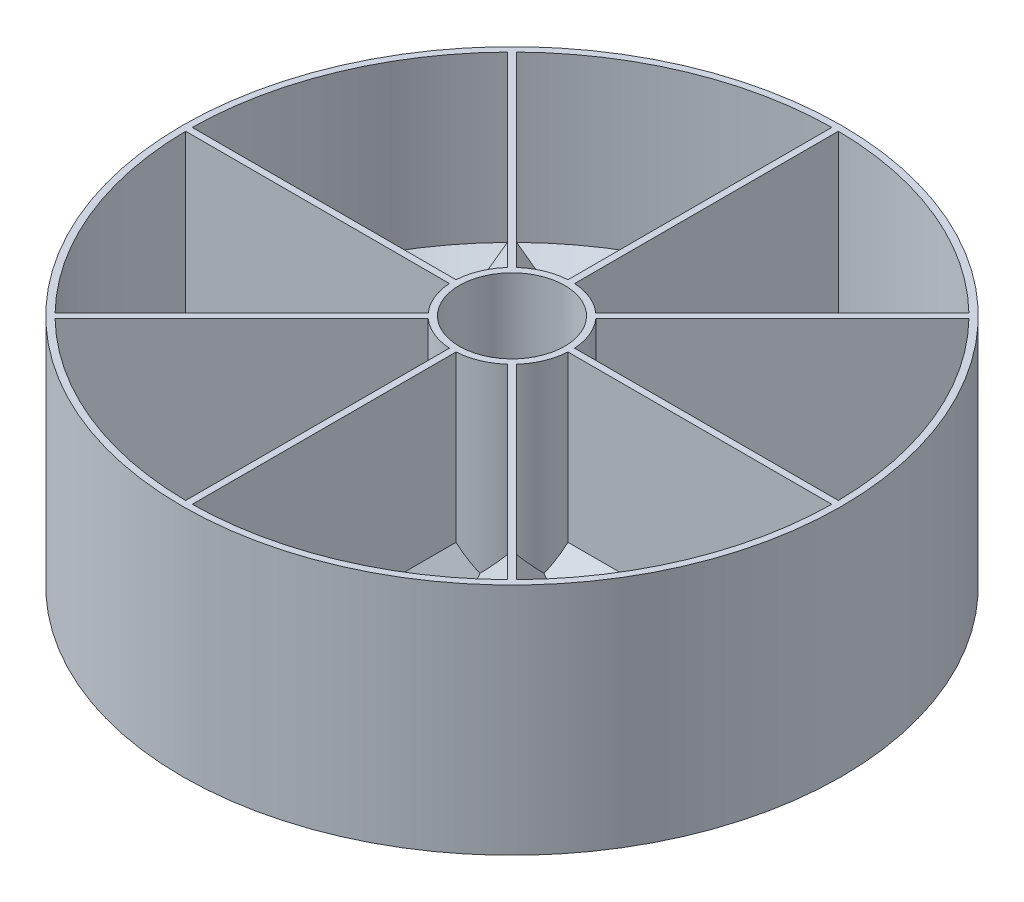
from build123d import *

# Parameters (mm, degrees)
SKETCH2_R           = 100
SKETCH2_R_2         = 98
BOSS_EXTRUDE2_DEPTH = 70
SKETCH3_R           = 18
SKETCH3_R_2         = 16
BOSS_EXTRUDE3_DEPTH = 70
BOSS_EXTRUDE4_DEPTH = 70
CIRPATTERN1_COUNT   = 8
BOSS_EXTRUDE5_START = 1
SKETCH5_R           = 100
BOSS_EXTRUDE5_DEPTH = 1
SKETCH9_R           = 16
BOSS_EXTRUDE6_DEPTH = 10
CUT_EXTRUDE2_DEPTH  = 154.622914957
CHAMFER1_SIZE       = 20
CUT_EXTRUDE3_DEPTH  = 158.797338381
CIRPATTERN2_COUNT   = 8


with BuildPart() as part:
    # Sketch2 → Boss-Extrude2 (new body)
    with BuildSketch(Plane(origin=(0, 0, 0), x_dir=(1, 0, 0), z_dir=(0, 1, 0))):
        Circle(SKETCH2_R)
        Circle(SKETCH2_R_2, mode=Mode.SUBTRACT)
    extrude(amount=BOSS_EXTRUDE2_DEPTH)



with BuildPart() as body_2:
    # Sketch3 → Boss-Extrude3 (new body)
    with BuildSketch(Plane(origin=(0, 0, 0), x_dir=(1, 0, 0), z_dir=(0, 1, 0))):
        Circle(SKETCH3_R)
        Circle(SKETCH3_R_2, mode=Mode.SUBTRACT)
    extrude(amount=BOSS_EXTRUDE3_DEPTH)

    # Sketch4 → Boss-Extrude4 (add)
    with BuildSketch(Plane(origin=(0, 0, 0), x_dir=(1, 0, 0), z_dir=(0, 1, 0))):
        with BuildLine():
            ThreePointArc((1, -17.972200756), (0, -18), (-1, -17.972200756))
            Line((-1, -17.972200756), (-1, -97.994897826))
            ThreePointArc((-1, -97.994897826), (0, -98), (1, -97.994897826))
            Line((1, -97.994897826), (1, -17.972200756))
        make_face()
    boss_extrude4 = extrude(amount=BOSS_EXTRUDE4_DEPTH)

    # CirPattern1: Boss-Extrude4 ×8 about axis
    cirpattern1_axis = Axis((0, 70, 0), (0, -1, 0))
    for i in range(1, CIRPATTERN1_COUNT):
        add(boss_extrude4.rotate(cirpattern1_axis, i * 360 / CIRPATTERN1_COUNT))


with BuildPart() as part_1:
    add(part.part)

    add(body_2.part)  # Boss-Extrude5 merges body 2
    # Sketch5 → Boss-Extrude5 (add)
    with BuildSketch(Plane.XZ.offset(BOSS_EXTRUDE5_START)):
        Circle(SKETCH5_R)
    extrude(amount=-BOSS_EXTRUDE5_DEPTH)

    # Sketch9 → Boss-Extrude6 (add)
    with BuildSketch(Plane(origin=(0, 0, 0), x_dir=(1, 0, 0), z_dir=(0, 1, 0))):
        Circle(SKETCH9_R)
    extrude(amount=BOSS_EXTRUDE6_DEPTH)

    # Sketch10 → Cut-Extrude2 (cut, through all)
    with BuildSketch(Plane(origin=(0, 10, 0), x_dir=(1, 0, 0), z_dir=(0, 1, 0))):
        Polygon((0, 16), (-13.856406461, 8), (-13.856406461, -8), (0, -16), (13.856406461, -8), (13.856406461, 8), align=None)
    extrude(amount=-CUT_EXTRUDE2_DEPTH, mode=Mode.SUBTRACT)

    # Chamfer1
    chamfer1_edges = [part_1.edges().sort_by_distance(p)[0] for p in [
        (40.29345412, 0, -41.707667682),
    ]]
    chamfer(chamfer1_edges, length=CHAMFER1_SIZE)
    chamfer1_2_edges = [part_1.edges().sort_by_distance(p)[0] for p in [
        (40.29345412, 0, 41.707667682),
    ]]
    chamfer(chamfer1_2_edges, length=CHAMFER1_SIZE)
    chamfer1_3_edges = [part_1.edges().sort_by_distance(p)[0] for p in [
        (1, 0, 64.346691318),
    ]]
    chamfer(chamfer1_3_edges, length=CHAMFER1_SIZE)
    chamfer1_4_edges = [part_1.edges().sort_by_distance(p)[0] for p in [
        (-57.983549291, 0, 1),
    ]]
    chamfer(chamfer1_4_edges, length=CHAMFER1_SIZE)
    chamfer1_5_edges = [part_1.edges().sort_by_distance(p)[0] for p in [
        (-40.29345412, 0, 41.707667682),
    ]]
    chamfer(chamfer1_5_edges, length=CHAMFER1_SIZE)
    chamfer1_6_edges = [part_1.edges().sort_by_distance(p)[0] for p in [
        (-1, 0, 64.346691318),
    ]]
    chamfer(chamfer1_6_edges, length=CHAMFER1_SIZE)
    chamfer1_7_edges = [part_1.edges().sort_by_distance(p)[0] for p in [
        (41.707667682, 0, 40.29345412),
    ]]
    chamfer(chamfer1_7_edges, length=CHAMFER1_SIZE)
    chamfer1_8_edges = [part_1.edges().sort_by_distance(p)[0] for p in [
        (64.346691318, 0, 1),
    ]]
    chamfer(chamfer1_8_edges, length=CHAMFER1_SIZE)
    chamfer1_9_edges = [part_1.edges().sort_by_distance(p)[0] for p in [
        (57.983549291, 0, -1),
    ]]
    chamfer(chamfer1_9_edges, length=CHAMFER1_SIZE)
    chamfer1_10_edges = [part_1.edges().sort_by_distance(p)[0] for p in [
        (46.207088559, 0, -44.792874997),
    ]]
    chamfer(chamfer1_10_edges, length=CHAMFER1_SIZE)
    chamfer1_11_edges = [part_1.edges().sort_by_distance(p)[0] for p in [
        (1, 0, -64.346691318),
    ]]
    chamfer(chamfer1_11_edges, length=CHAMFER1_SIZE)
    chamfer1_12_edges = [part_1.edges().sort_by_distance(p)[0] for p in [
        (-1, 0, -57.983549291),
    ]]
    chamfer(chamfer1_12_edges, length=CHAMFER1_SIZE)
    chamfer1_13_edges = [part_1.edges().sort_by_distance(p)[0] for p in [
        (-41.707667682, 0, -40.29345412),
    ]]
    chamfer(chamfer1_13_edges, length=CHAMFER1_SIZE)
    chamfer1_14_edges = [part_1.edges().sort_by_distance(p)[0] for p in [
        (-64.346691318, 0, -1),
    ]]
    chamfer(chamfer1_14_edges, length=CHAMFER1_SIZE)
    chamfer1_15_edges = [part_1.edges().sort_by_distance(p)[0] for p in [
        (-46.207088559, 0, 44.792874997),
    ]]
    chamfer(chamfer1_15_edges, length=CHAMFER1_SIZE)
    chamfer1_16_edges = [part_1.edges().sort_by_distance(p)[0] for p in [
        (-44.792874997, 0, -46.207088559),
    ]]
    chamfer(chamfer1_16_edges, length=CHAMFER1_SIZE)
    chamfer1_17_edges = [part_1.edges().sort_by_distance(p)[0] for p in [
        (90.540194186, 0, 37.502976372),
    ]]
    chamfer(chamfer1_17_edges, length=CHAMFER1_SIZE)
    chamfer1_18_edges = [part_1.edges().sort_by_distance(p)[0] for p in [
        (37.502976372, 0, 90.540194186),
    ]]
    chamfer(chamfer1_18_edges, length=CHAMFER1_SIZE)
    chamfer1_19_edges = [part_1.edges().sort_by_distance(p)[0] for p in [
        (-90.540194186, 0, 37.502976372),
    ]]
    chamfer(chamfer1_19_edges, length=CHAMFER1_SIZE)
    chamfer1_20_edges = [part_1.edges().sort_by_distance(p)[0] for p in [
        (37.502976372, 0, -90.540194186),
    ]]
    chamfer(chamfer1_20_edges, length=CHAMFER1_SIZE)
    chamfer1_21_edges = [part_1.edges().sort_by_distance(p)[0] for p in [
        (-90.540194186, 0, -37.502976372),
    ]]
    chamfer(chamfer1_21_edges, length=CHAMFER1_SIZE)
    chamfer1_22_edges = [part_1.edges().sort_by_distance(p)[0] for p in [
        (90.540194186, 0, -37.502976372),
    ]]
    chamfer(chamfer1_22_edges, length=CHAMFER1_SIZE)
    chamfer1_23_edges = [part_1.edges().sort_by_distance(p)[0] for p in [
        (-37.502976372, 0, 90.540194186),
    ]]
    chamfer(chamfer1_23_edges, length=CHAMFER1_SIZE)
    chamfer1_24_edges = [part_1.edges().sort_by_distance(p)[0] for p in [
        (-37.502976372, 0, -90.540194186),
    ]]
    chamfer(chamfer1_24_edges, length=CHAMFER1_SIZE)

    # Sketch11 → Cut-Extrude3 (cut, through all)
    with BuildSketch(Plane(origin=(0, 0, 0), x_dir=(1, 0, 0), z_dir=(0, 1, 0))):
        Polygon((-21, -50.69848481), (-38.268551224, -67.967036034), (-21, -75.119904153), align=None)
    cut_extrude3 = extrude(amount=-CUT_EXTRUDE3_DEPTH, mode=Mode.SUBTRACT)

    # CirPattern2: Cut-Extrude3 ×8 about axis
    cirpattern2_axis = Axis((0, 70, 0), (0, -1, 0))
    for i in range(1, CIRPATTERN2_COUNT):
        add(cut_extrude3.rotate(cirpattern2_axis, i * 360 / CIRPATTERN2_COUNT), mode=Mode.SUBTRACT)


solid = part_1.part
